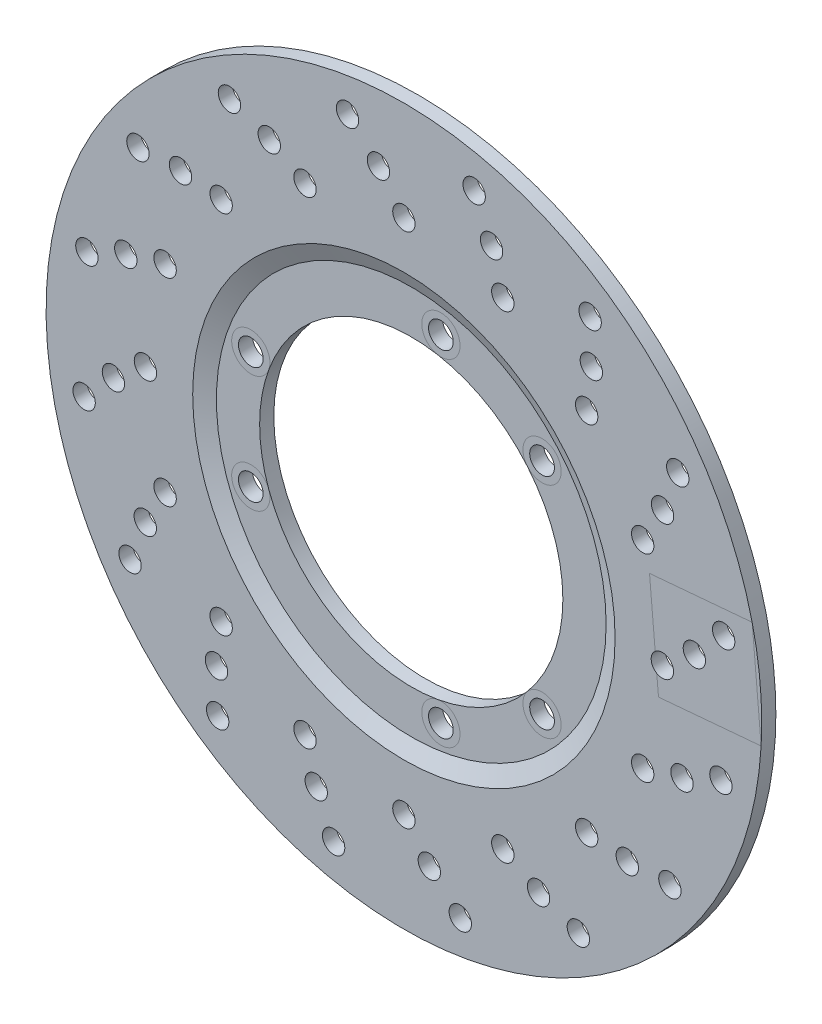
from build123d import *

# Parameters (mm, degrees)
SKETCH3_R                  = 51.5
CUT_EXTRUDE1_DEPTH         = 173.052593703
SKETCH4_R                  = 4.2
CUT_EXTRUDE2_DEPTH         = 173.052593703
F_7_6_7_6_DIAMETER_HOLE1_D = 7.6
CIRPATTERN1_COUNT          = 16


with BuildPart() as part:
    # Sketch2 → Revolve1 (revolve)
    with BuildSketch(Plane(origin=(0, 0, 0), x_dir=(1, 0, 0), z_dir=(0, 1, 0))):
        Polygon((0, 0), (0, 4.8), (-71, 4.8), (-76.55, 2.3), (-121.55, 2.3), (-121.55, -2.5), (-71.744825756, -2.5), (-66.194825756, 0), align=None)
    revolve(axis=Axis((0, 0, 0), (0, 0, -1)))

    # Sketch3 → Cut-Extrude1 (cut, through all)
    with BuildSketch(Plane(origin=(0, 0, -4.8), x_dir=(-1, 0, 0), z_dir=(0, 0, -1))):
        Circle(SKETCH3_R)
    extrude(amount=-CUT_EXTRUDE1_DEPTH, mode=Mode.SUBTRACT)

    # Sketch4 → Cut-Extrude2 (cut, through all)
    with BuildSketch(Plane(origin=(0, 0, -4.8), x_dir=(-1, 0, 0), z_dir=(0, 0, -1))):
        with Locations((-10.071594305, -57.118849675)):
            Circle(SKETCH4_R)
        with Locations((-44.430577701, -37.281681362)):
            Circle(SKETCH4_R)
        with Locations((54.502172006, -19.837168313)):
            Circle(SKETCH4_R)
        with Locations((54.502172006, 19.837168313)):
            Circle(SKETCH4_R)
        with Locations((-10.071594305, 57.118849675)):
            Circle(SKETCH4_R)
        with Locations((-44.430577701, 37.281681362)):
            Circle(SKETCH4_R)
    extrude(amount=-CUT_EXTRUDE2_DEPTH, mode=Mode.SUBTRACT)

    # Ø7.6 (7.6) Diameter Hole1 (through all)
    with Locations(Plane(origin=(0, 0, -2.3), x_dir=(-1, 0, 0), z_dir=(0, 0, -1))):
        with Locations((108.624295157, -19.153393997), (87.8, 0), (98.673084846, -8.632776319)):
            f_7_6_7_6_diameter_hole1 = Hole(F_7_6_7_6_DIAMETER_HOLE1_D / 2)

    # CirPattern1: Ø7.6 (7.6) Diameter Hole1 ×16 about axis
    cirpattern1_axis = Axis((0, 0, -4.8), (0, 0, -1))
    for i in range(1, CIRPATTERN1_COUNT):
        add(f_7_6_7_6_diameter_hole1.rotate(cirpattern1_axis, i * 360 / CIRPATTERN1_COUNT), mode=Mode.SUBTRACT)


solid = part.part
